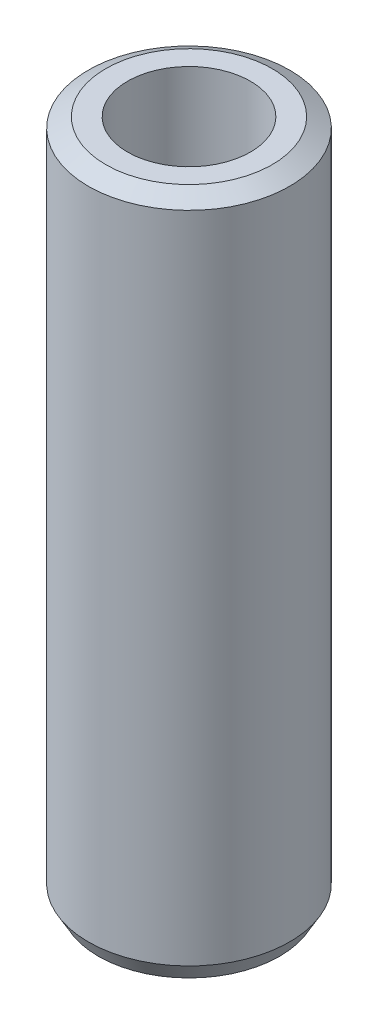
from build123d import *
from OCP.BRepFilletAPI import BRepFilletAPI_MakeChamfer

# Parameters (mm, degrees)
SKETCH1_R           = 27.5
BOSS_EXTRUDE1_DEPTH = 186.252866448
SKETCH2_R           = 16.784693531
CUT_EXTRUDE1_DEPTH  = 191.269887949
CHAMFER1_SIZE       = 2.72773437
CHAMFER1_SIZE2      = 4.766559635


with BuildPart() as part:
    # Sketch1 → Boss-Extrude1 (new body)
    with BuildSketch(Plane(origin=(0, 0, 0), x_dir=(1, 0, 0), z_dir=(0, 1, 0))):
        Circle(SKETCH1_R)
    extrude(amount=BOSS_EXTRUDE1_DEPTH)

    # Sketch2 → Cut-Extrude1 (cut, through all)
    with BuildSketch(Plane(origin=(0, 0, 0), x_dir=(1, 0, 0), z_dir=(0, 1, 0))):
        Circle(SKETCH2_R)
    extrude(amount=CUT_EXTRUDE1_DEPTH, mode=Mode.SUBTRACT)

    # Chamfer1: one chamfer whose edges measure the first distance from different faces: ONE call of the kernel's chamfer builder (chamfer() names one face for all edges)
    chamfer1_edges_1 = [part.edges().sort_by_distance(p)[0] for p in [
        (-27.5, 186.252866448, 0),
    ]]
    chamfer1_side_1 = [part.faces().sort_by_distance(p)[0] for p in [
        (-27.5, 93.126433224, 0),
    ]]
    chamfer1_edges_2 = [part.edges().sort_by_distance(p)[0] for p in [
        (-27.5, 0, 0),
    ]]
    chamfer1_side_2 = [part.faces().sort_by_distance(p)[0] for p in [
        (-26.722182541, 0, 0),
    ]]
    chamfer1 = BRepFilletAPI_MakeChamfer(part.part.solid().wrapped)
    for e in chamfer1_edges_1:
        chamfer1.Add(CHAMFER1_SIZE, CHAMFER1_SIZE2, e.wrapped, chamfer1_side_1[0].wrapped)  # the first distance lies on this face
    for e in chamfer1_edges_2:
        chamfer1.Add(CHAMFER1_SIZE, CHAMFER1_SIZE2, e.wrapped, chamfer1_side_2[0].wrapped)  # the first distance lies on this face
    add(Compound.cast(chamfer1.Shape()), mode=Mode.REPLACE)


solid = part.part
